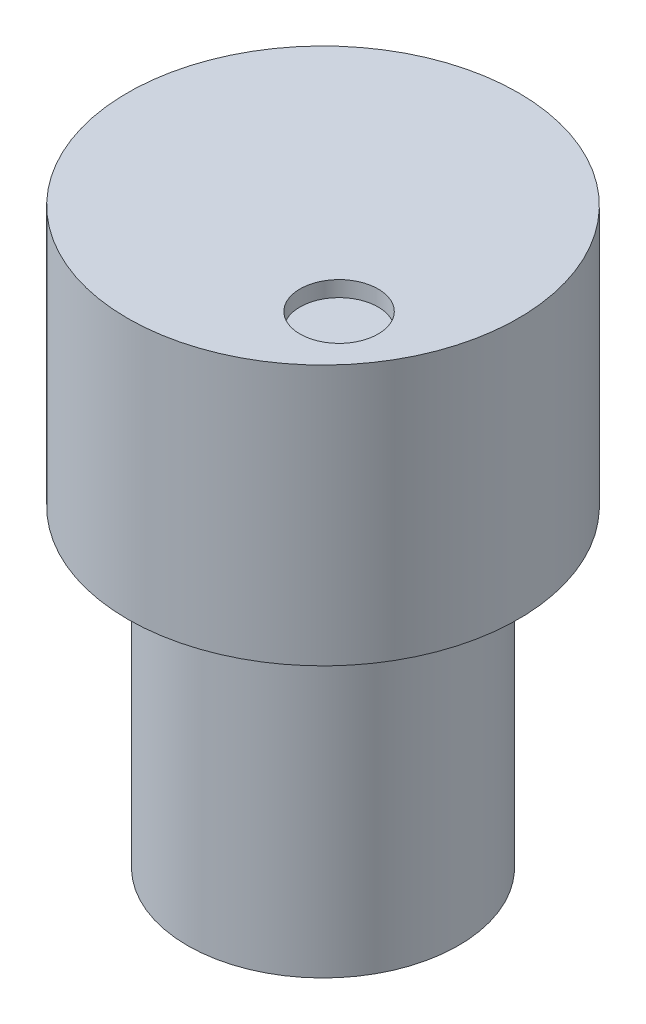
from build123d import *

# Parameters (mm, degrees)
SKETCH1_R           = 5.2
SKETCH1_R_2         = 3.2
BOSS_EXTRUDE1_DEPTH = 12
SKETCH2_R           = 7.5
BOSS_EXTRUDE2_DEPTH = 10
BOSS_EXTRUDE4_START = 5
BOSS_EXTRUDE4_DEPTH = 5
SKETCH5_R           = 1.5
CUT_EXTRUDE1_DEPTH  = 0.6


with BuildPart() as part:
    # Sketch1 → Boss-Extrude1 (new body)
    with BuildSketch(Plane(origin=(0, 0, 0), x_dir=(1, 0, 0), z_dir=(0, 1, 0))):
        Circle(SKETCH1_R)
        Circle(SKETCH1_R_2, mode=Mode.SUBTRACT)
    extrude(amount=BOSS_EXTRUDE1_DEPTH)

    # Sketch2 → Boss-Extrude2 (add)
    with BuildSketch(Plane(origin=(0, 12, 0), x_dir=(1, 0, 0), z_dir=(0, 1, 0))):
        Circle(SKETCH2_R)
    extrude(amount=BOSS_EXTRUDE2_DEPTH)

    # Sketch4 → Boss-Extrude4 (add)
    with BuildSketch(Plane.XZ.offset(-12).offset(BOSS_EXTRUDE4_START)):
        with BuildLine():
            Line((2.645751311, -1.8), (-2.645751311, -1.8))
            ThreePointArc((-2.645751311, -1.8), (0, -3.2), (2.645751311, -1.8))
        make_face()
    extrude(amount=-BOSS_EXTRUDE4_DEPTH)

    # Sketch5 → Cut-Extrude1 (cut)
    with BuildSketch(Plane(origin=(0, 22, 0), x_dir=(1, 0, 0), z_dir=(0, 1, 0))):
        with Locations((3.830222216, -3.213938048)):
            Circle(SKETCH5_R)
    extrude(amount=-CUT_EXTRUDE1_DEPTH, mode=Mode.SUBTRACT)


solid = part.part
